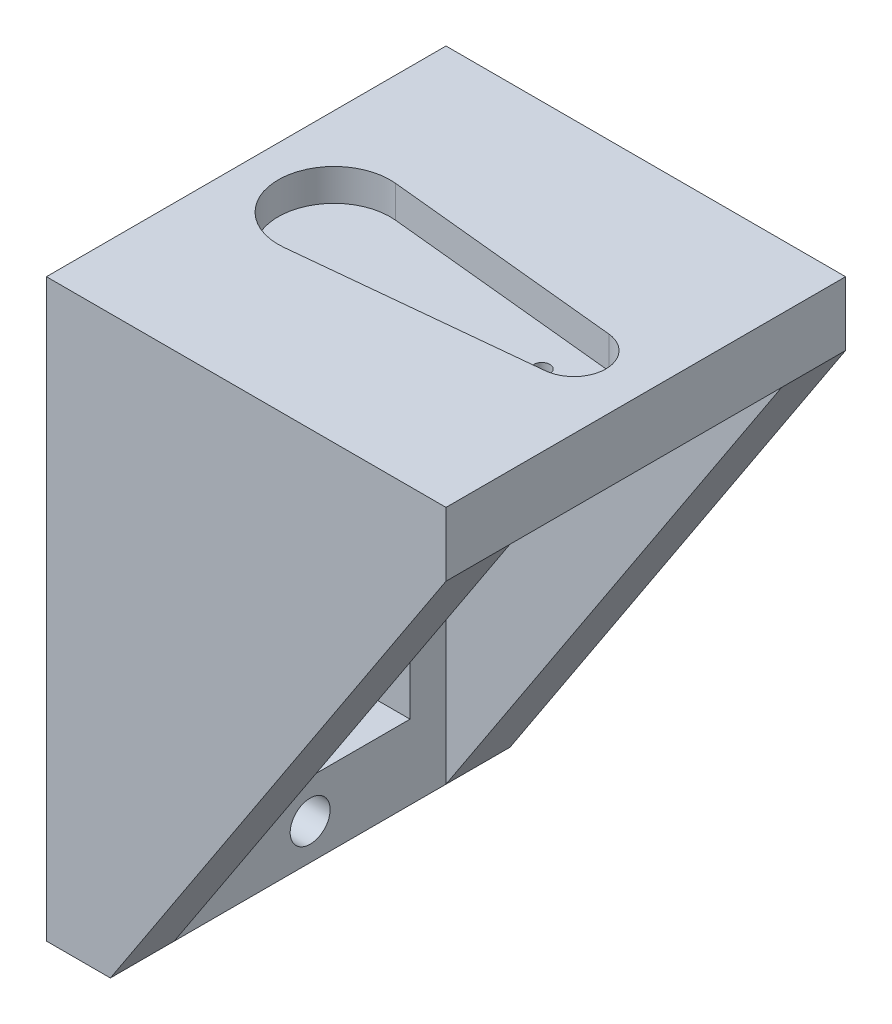
from build123d import *

# Parameters (mm, degrees)
SKETCH_2_W               = 25
SKETCH_2_H               = 25
EXTRUDE_1_DEPTH          = 4
EXTRUDE_2_DEPTH          = 4
CUT_EXTRUDE_START        = -6
CUT_EXTRUDE_1_DEPTH      = 6
SKETCH_8_R               = 0.5
CUT_EXTRUDE_2_DEPTH      = 6
EXTRUDE_3_DEPTH          = 32
CUT_EXTRUDE_4_DEPTH      = 32
CUT_EXTRUDE_4_DEPTH_BACK = 32
SKETCH_13_R              = 1.25
SKETCH_13_W              = 12.5
SKETCH_13_H              = 22.7
CUT_EXTRUDE_5_DEPTH      = 41.264560711


with BuildPart() as part:
    # 草图2 → 凸台-拉伸1 (new body)
    with BuildSketch(Plane(origin=(0, 0, 0), x_dir=(1, 0, 0), z_dir=(0, 1, 0))):
        Rectangle(SKETCH_2_W, SKETCH_2_H)
    extrude(amount=EXTRUDE_1_DEPTH)

    # 草图3 → 凸台-拉伸2 (add)
    with BuildSketch(Plane(origin=(0, 4, 0), x_dir=(1, 0, 0), z_dir=(0, 1, 0))):
        with BuildLine():
            Line((8.2, 1.989974874), (-6.65, 3.48245603))
            ThreePointArc((-6.65, 3.48245603), (-10.5, 0), (-6.65, -3.48245603))
            Line((-6.65, -3.48245603), (8.2, -1.989974874))
            ThreePointArc((8.2, -1.989974874), (10, 0), (8.2, 1.989974874))
        make_face()
    extrude(amount=EXTRUDE_2_DEPTH)

    # 草图7 → 切除-拉伸1 (cut)
    with BuildSketch(Plane(origin=(0, 8, 0), x_dir=(1, 0, 0), z_dir=(0, 1, 0)).offset(CUT_EXTRUDE_START)):
        with BuildLine():
            Line((-6.65, -3.48245603), (8.2, -1.989974874))
            ThreePointArc((8.2, -1.989974874), (10, 0), (8.2, 1.989974874))
            Line((8.2, 1.989974874), (-6.65, 3.48245603))
            ThreePointArc((-6.65, 3.48245603), (-10.5, 0), (-6.65, -3.48245603))
        make_face()
    extrude(amount=CUT_EXTRUDE_1_DEPTH, mode=Mode.SUBTRACT)

    # 草图8 → 切除-拉伸2 (cut)
    with BuildSketch(Plane(origin=(0, 2, 0), x_dir=(1, 0, 0), z_dir=(0, 1, 0))):
        with Locations((6, 0)):
            Circle(SKETCH_8_R)
    extrude(amount=-CUT_EXTRUDE_2_DEPTH, mode=Mode.SUBTRACT)

    # 草图11 → 凸台-拉伸3 (add)
    with BuildSketch(Plane.XZ):
        Polygon((-8.499639265, -8.5), (-8.499639265, 8.5), (12.5, 8.5), (12.5, 12.5), (-12.5, 12.5), (-12.5, -12.5), (12.5, -12.5), (12.5, -8.5), align=None)
    extrude(amount=EXTRUDE_3_DEPTH)

    # 草图12 → 切除-拉伸4 (cut, two sides: drawn at the far end of the back side and taken through both)
    with BuildSketch(Plane.XY.offset(-8.5).offset(-CUT_EXTRUDE_4_DEPTH_BACK)):
        Polygon((12.5, 0), (-8.499639265, -32), (12.5, -32), align=None)
    extrude(amount=CUT_EXTRUDE_4_DEPTH + CUT_EXTRUDE_4_DEPTH_BACK, mode=Mode.SUBTRACT)

    # 草图13 → 切除-拉伸5 (cut, through all)
    with BuildSketch(Plane(origin=(-8.499639265, 0, 0), x_dir=(0, 0, -1), z_dir=(1, 0, 0))):
        with Locations((0, -29.75)):
            Circle(SKETCH_13_R)
        with Locations((0, -2.25)):
            Circle(SKETCH_13_R)
        with Locations((0, -16)):
            Rectangle(SKETCH_13_W, SKETCH_13_H)
    extrude(amount=-CUT_EXTRUDE_5_DEPTH, mode=Mode.SUBTRACT)


solid = part.part
